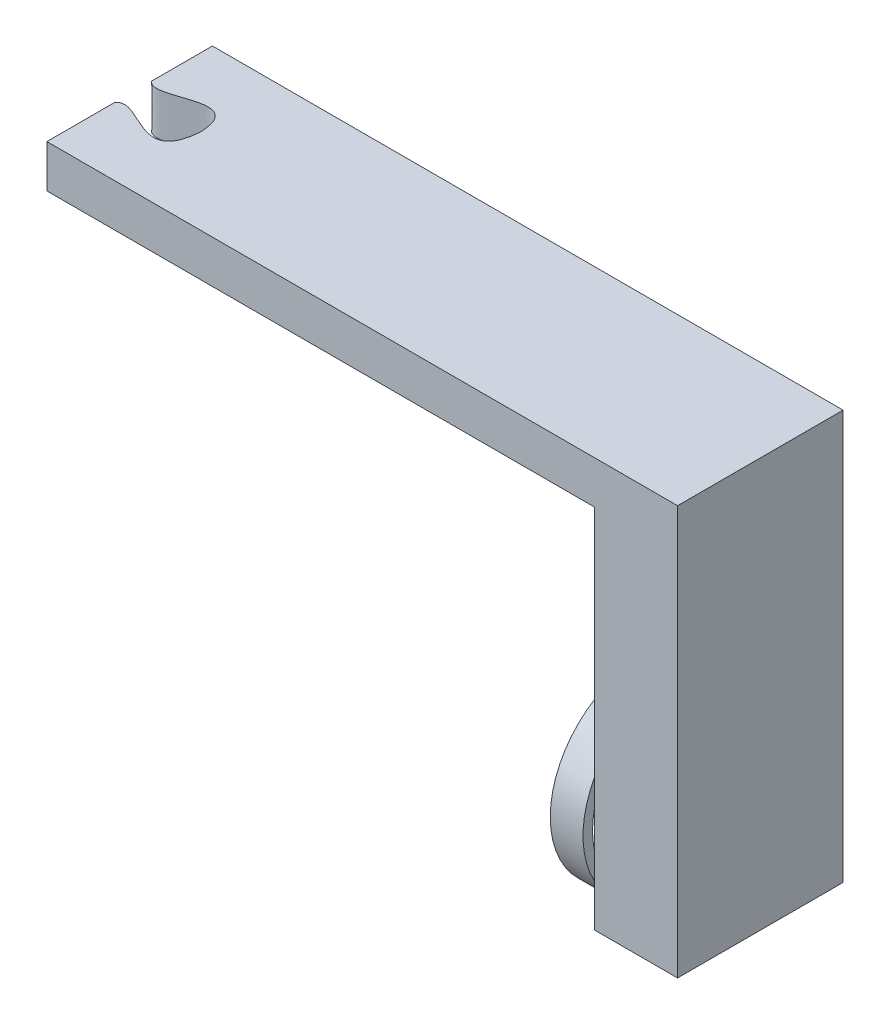
from build123d import *

# Parameters (mm, degrees)
BOSS_EXTRUDE1_DEPTH = 10
SKETCH5_W           = 19.453021512
SKETCH5_H           = 38.694970839
BOSS_EXTRUDE2_DEPTH = 85.63051792
SKETCH6_R           = 22
SKETCH6_R_2         = 19.780571117
BOSS_EXTRUDE5_DEPTH = 7.660427645
FILLET10_R          = 2.5
FILLET11_R          = 2.5


with BuildPart() as part:
    # Sketch1 → Boss-Extrude1 (new body)
    with BuildSketch(Plane(origin=(0, 0, 0), x_dir=(1, 0, 0), z_dir=(0, 1, 0))):
        with BuildLine():
            Line((0, 24.518151768), (0, 38.694970839))
            Line((0, 38.694970839), (147.451699193, 38.694970839))
            Line((147.451699193, 38.694970839), (147.451699193, 0))
            Line((147.451699193, 0), (0, 0))
            Line((0, 0), (0, 15.74024552))
            add(Edge.make_bspline(
                [(0, 15.74024552), (2.540846011, 20.138217128), (14.801575787, 5.452312854), (15.995670115, 19.711234682)],
                knots=[0, 0, 0, 0, 1, 1, 1, 1], degree=3))
            add(Edge.make_bspline(
                [(0, 24.518151768), (3.025411482, 20.257839716), (15.777331359, 32.77346932), (15.995670115, 19.711234682)],
                knots=[0, 0, 0, 0, 1, 1, 1, 1], degree=3))
        make_face()
    extrude(amount=BOSS_EXTRUDE1_DEPTH)

    # Sketch5 → Boss-Extrude2 (add)
    with BuildSketch(Plane.XZ):
        with Locations((137.725188437, -19.347485419)):
            Rectangle(SKETCH5_W, SKETCH5_H)
    extrude(amount=BOSS_EXTRUDE2_DEPTH)

    # Sketch6 → Boss-Extrude5 (add)
    with BuildSketch(Plane.ZY.offset(-127.998677681)):
        with Locations(Location((-19.34748542, -65.278, 0), (0, 0, 151.573820003))):
            Circle(SKETCH6_R)
        with Locations(Location((-19.34748542, -65.278, 0), (0, 0, 192.011596254))):
            Circle(SKETCH6_R_2, mode=Mode.SUBTRACT)
    extrude(amount=BOSS_EXTRUDE5_DEPTH)

    # Fillet10
    # the kernel refuses this fillet: 2.5 mm, written as the material it takes off along each edge
    with BuildSketch(Plane(origin=(127.998677681, -65.278, -19.34748542), x_dir=(0, 0.7021921970481064, -0.711987442589231), z_dir=(0, 0.711987442589231, 0.7021921970481064))) as fillet10_piece_1_section:
        with BuildLine():
            CenterArc((19.5, 2.48420608), FILLET10_R, 276.443791757, 83.556208243)
            Line((22, 2.48420608), (22, 0))
            Line((22, 0), (19.780571117, 0))
        make_face()
    fillet10_piece_1 = revolve(axis=Axis((127.998677681, -65.278, -19.34748542), (-1, 0, 0)), revolution_arc=89.20629991, mode=Mode.PRIVATE)
    fillet10_piece_1 = split(fillet10_piece_1, bisect_by=Plane(origin=(127.183421673, -65.278, -38.694970839), z_dir=(0, 0, -1)), keep=Keep.TOP, mode=Mode.PRIVATE)
    add(fillet10_piece_1, mode=Mode.SUBTRACT)

    # Fillet11
    # the kernel refuses this fillet: 2.5 mm, written as the material it takes off along each edge
    with BuildSketch(Plane(origin=(127.998677681, -65.278, -19.34748542), x_dir=(0, -0.7815945319539552, -0.6237868126368795), z_dir=(0, 0.6237868126368795, -0.7815945319539552))) as fillet11_piece_1_section:
        with BuildLine():
            CenterArc((22 - FILLET11_R, FILLET11_R), FILLET11_R, 270, 90)
            Line((22, FILLET11_R), (22, 0))
            Line((22, 0), (22 - FILLET11_R, 0))
        make_face()
    fillet11_piece_1 = revolve(axis=Axis((127.998677681, -65.278, -19.34748542), (-1, 0, 0)), revolution_arc=77.186396047, mode=Mode.PRIVATE)
    fillet11_piece_1 = split(fillet11_piece_1, bisect_by=Plane(origin=(127.364659544, -85.63051792, -19.347486624), z_dir=(0, -1, 0)), keep=Keep.TOP, mode=Mode.PRIVATE)
    add(fillet11_piece_1, mode=Mode.SUBTRACT)


solid = part.part
